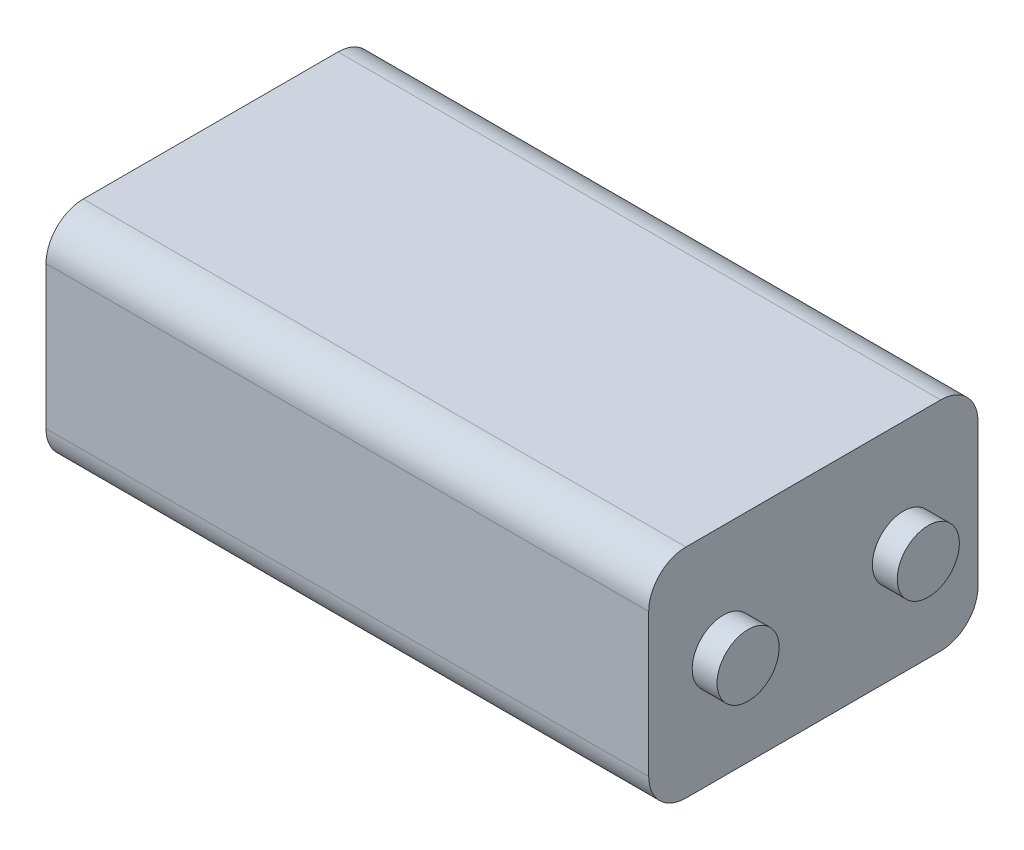
from build123d import *

# Parameters (mm, degrees)
SKETCH_1_W      = 48.5
SKETCH_1_H      = 17.5
EXTRUDE_1_DEPTH = 26.5
FILLET_1_R      = 3
SKETCH_2_R      = 2.5
EXTRUDE_2_DEPTH = 2


with BuildPart() as part:
    # ｽｹｯﾁ1 → ﾎﾞｽ - 押し出し1 (new body)
    with BuildSketch(Plane.XY):
        Rectangle(SKETCH_1_W, SKETCH_1_H)
    extrude(amount=EXTRUDE_1_DEPTH)

    # ﾌｨﾚｯﾄ1
    fillet_1_edges = [part.edges().sort_by_distance(p)[0] for p in [
        (0, -8.75, 26.5),
        (0, -8.75, 0),
        (0, 8.75, 0),
        (0, 8.75, 26.5),
    ]]
    fillet(fillet_1_edges, radius=FILLET_1_R)

    # ｽｹｯﾁ2 → ﾎﾞｽ - 押し出し2 (add)
    with BuildSketch(Plane(origin=(24.25, 0, 0), x_dir=(0, 0, -1), z_dir=(1, 0, 0))):
        with Locations((-20.5, 0)):
            Circle(SKETCH_2_R)
        with Locations((-6, 0)):
            Circle(SKETCH_2_R)
    extrude(amount=EXTRUDE_2_DEPTH)


solid = part.part
